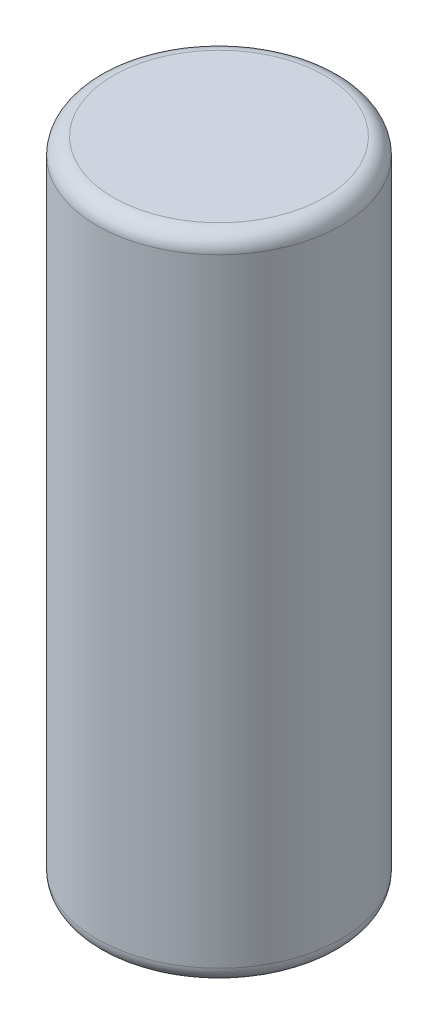
from build123d import *

# Parameters (mm, degrees)
SKETCH1_R           = 75
BOSS_EXTRUDE1_DEPTH = 200
FILLET1_R           = 10


with BuildPart() as part:
    # Sketch1 → Boss-Extrude1 (new, symmetric)
    with BuildSketch(Plane(origin=(0, 0, 0), x_dir=(1, 0, 0), z_dir=(0, 1, 0))):
        Circle(SKETCH1_R)
    extrude(amount=BOSS_EXTRUDE1_DEPTH, both=True)

    # Fillet1
    fillet1_edges = [part.edges().sort_by_distance(p)[0] for p in [
        (-75, 200, 0),
        (-75, -200, 0),
    ]]
    fillet(fillet1_edges, radius=FILLET1_R)


solid = part.part
